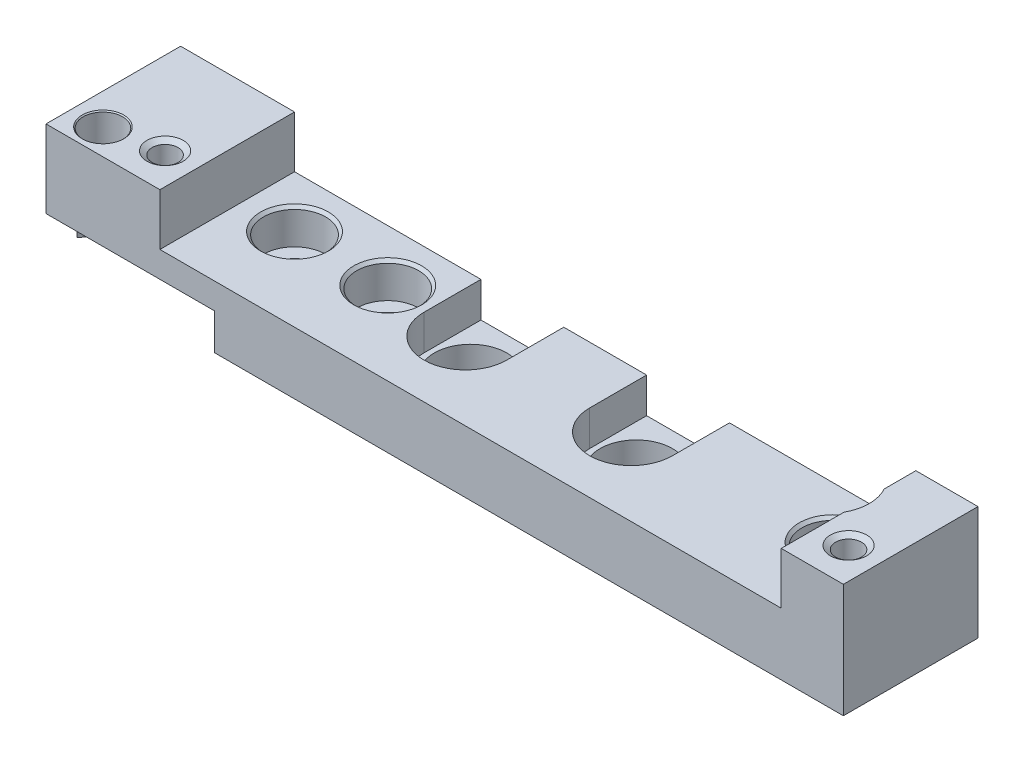
from build123d import *

# Parameters (mm, degrees)
SKETCH_1_W                 = 13
SKETCH_1_H                 = 11
EXTRUDE_1_DEPTH            = 77
SKETCH_2_W                 = 60
SKETCH_2_H                 = 5
CUT_EXTRUDE_1_DEPTH        = 79.860636569
CUT_EXTRUDE_2_DEPTH        = 5
HOLE_WIZARD_M31_AT_2_COUNT = 2
HOLE_WIZARD_M31_AT_2_PITCH = 52
HOLE_WIZARD_M31_AT_3_COUNT = 2
HOLE_WIZARD_M31_AT_3_PITCH = 9
CUT_EXTRUDE_3_DEPTH        = 3.5
CUT_EXTRUDE_5_DEPTH        = 3.4
SKETCH_12_R                = 3.5
CUT_EXTRUDE_6_DEPTH        = 10


# Read off the part's stored shape, not the designer's step: Отверстие обработанное метчиком M32
with BuildPart() as part:
    # Эскиз1 → Бобышка-Вытянуть1 (new body)
    with BuildSketch(Plane(origin=(0, 0, 0), x_dir=(0, 0, -1), z_dir=(1, 0, 0))):
        with Locations((6.5, 5.5)):
            Rectangle(SKETCH_1_W, SKETCH_1_H)
    extrude(amount=EXTRUDE_1_DEPTH)

    # Эскиз2 → Вырез-Вытянуть1 (cut, through all)
    with BuildSketch(Plane.XY):
        with Locations((41, 8.5)):
            Rectangle(SKETCH_2_W, SKETCH_2_H)
    extrude(amount=-CUT_EXTRUDE_1_DEPTH, mode=Mode.SUBTRACT)

    # Эскиз5 → Вырез-Вытянуть2 (cut)
    with BuildSketch(Plane(origin=(0, 11, 0), x_dir=(1, 0, 0), z_dir=(0, 1, 0))):
        with BuildLine():
            ThreePointArc((71, 6.063508327), (71.5, 8), (71, 9.936491673))
            Line((71, 9.936491673), (71, 6.063508327))
        make_face()
    extrude(amount=-CUT_EXTRUDE_2_DEPTH, mode=Mode.SUBTRACT)

    # Эскиз3 → Цековка для винта с внутренним шестигранником M31 (revolve, cut)
    with BuildSketch(Plane(origin=(16, 6, -8), x_dir=(0, 0, 1), z_dir=(1, 0, 0))):
        Polygon((0, 0), (0, 6), (1.625, 6), (1.6, 5.975), (1.6, 3.425), (1.625, 3.4), (3, 3.4), (3, 0.275), (3.275, 0), align=None)
    hole_wizard_m31 = revolve(axis=Axis((16, 12.35, -8), (0, -1, 0)), mode=Mode.SUBTRACT)

    # Цековка для винта с внутренним шестигранником M31 at 2: Цековка для винта с внутренним шестигранником M31 ×2
    with Locations(*[(i * HOLE_WIZARD_M31_AT_2_PITCH, 0, 0) for i in range(1, HOLE_WIZARD_M31_AT_2_COUNT)]):
        add(hole_wizard_m31, mode=Mode.SUBTRACT)

    # Цековка для винта с внутренним шестигранником M31 at 3: Цековка для винта с внутренним шестигранником M31 ×2
    with Locations(*[(i * HOLE_WIZARD_M31_AT_3_PITCH, 0, 0) for i in range(1, HOLE_WIZARD_M31_AT_3_COUNT)]):
        add(hole_wizard_m31, mode=Mode.SUBTRACT)

    # Эскиз8 → Вырез-Вытянуть3 (cut)
    with BuildSketch(Plane.XZ):
        with BuildLine():
            ThreePointArc((0, -2.974937186), (9.118315903, -6.853307497), (16.274964387, 0))
            Line((16.274964387, 0), (0, 0))
            Line((0, 0), (0, -2.974937186))
        make_face()
    extrude(amount=-CUT_EXTRUDE_3_DEPTH, mode=Mode.SUBTRACT)

    # Эскиз9 → Вырез-Вытянуть5 (cut)
    with BuildSketch(Plane.XZ.offset(-6)):
        with BuildLine():
            ThreePointArc((37, -7.5), (33, -3.5), (29, -7.5))
            Line((29, -7.5), (29, -13))
            Line((29, -13), (37, -13))
            Line((37, -13), (37, -7.5))
        make_face()
        with BuildLine():
            Line((45, -7.5), (45, -13))
            Line((45, -13), (53, -13))
            Line((53, -13), (53, -7.5))
            ThreePointArc((53, -7.5), (49, -3.5), (45, -7.5))
        make_face()
    extrude(amount=CUT_EXTRUDE_5_DEPTH, mode=Mode.SUBTRACT)

    # Отверстие обработанное метчиком M32 outline → Отверстие обработанное метчиком M32 (revolve, cut)
    with BuildSketch(Plane(origin=(74, 0, -3.5), x_dir=(1, 0, 0), z_dir=(0, 0, 1))):
        Polygon((0, 0), (1.75, 0), (1.25, 0.350103769), (1.25, 10.649896231), (1.75, 11), (0, 11), align=None)
    revolve(axis=Axis((74, 0, -3.5), (0, 1, 0)), mode=Mode.SUBTRACT)

    # Hole Wizard M32 2 outline → Hole Wizard M32 2 (revolve, cut)
    with BuildSketch(Plane(origin=(8, 0, -3.5), x_dir=(1, 0, 0), z_dir=(0, 0, 1))):
        Polygon((0, 3.5), (1.75, 3.5), (1.25, 3.850103769), (1.25, 10.649896231), (1.75, 11), (0, 11), align=None)
    revolve(axis=Axis((8, 0, -3.5), (0, 1, 0)), mode=Mode.SUBTRACT)

    # Эскиз10 → Цековка для винта с внутренним шестигранником M21 (revolve, cut)
    with BuildSketch(Plane(origin=(3, 11, -2.5), x_dir=(0, 0, 1), z_dir=(1, 0, 0))):
        Polygon((0, 0), (0, 7.5), (1.125, 7.5), (1.1, 7.475), (1.1, 3.525), (1.125, 3.5), (1.9, 3.5), (1.9, 0.1), (2, 0), align=None)
    revolve(axis=Axis((3, 17.35, -2.5), (0, -1, 0)), mode=Mode.SUBTRACT)

    # Эскиз12 → Вырез-Вытянуть6 (cut)
    with BuildSketch(Plane(origin=(0, 6, 0), x_dir=(1, 0, 0), z_dir=(0, 1, 0))):
        with Locations(Location((33, 8, 0), (0, 0, 270))):
            Circle(SKETCH_12_R)
        with Locations(Location((49, 8, 0), (0, 0, 270))):
            Circle(SKETCH_12_R)
    extrude(amount=-CUT_EXTRUDE_6_DEPTH, mode=Mode.SUBTRACT)


solid = part.part
